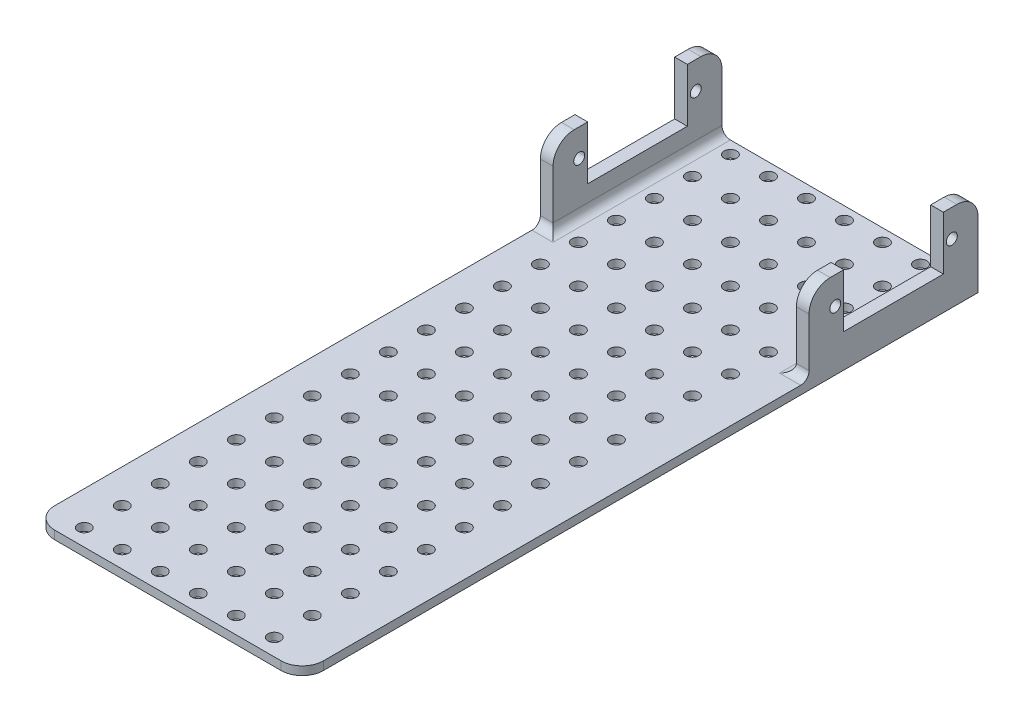
from build123d import *

# Parameters (mm, degrees)
SKETCH1_W               = 45
SKETCH1_H               = 160
BASE_DEPTH              = 2
SKETCH3_W               = 3
SKETCH3_H               = 40
SERVO_HOLDER_DEPTH      = 18.6
FILLET1_R               = 2
FILLET2_R               = 5
SKETCH4_R               = 1.3
SKETCH4_W               = 23.6
SKETCH4_H               = 12.7
CUT_EXTRUDE1_DEPTH      = 3.6
FILLET1_OF_MIRROR1_R    = 2
FILLET2_OF_MIRROR1_R    = 5
SKETCH7_R               = 1.5
CUT_EXTRUDE2_DEPTH      = 1.8
FILL_START              = 0.2
FILL_PATTERN1_OUTLINE_R = 1.5
FILL_PATTERN1_DEPTH     = 1.8
FILLET3_R               = 5


# Read off the part's stored shape, not the designer's step: Fill Pattern1
with BuildPart() as part:
    # Sketch1 → Base (new body)
    with BuildSketch(Plane(origin=(0, 0, 0), x_dir=(1, 0, 0), z_dir=(0, 1, 0))):
        with Locations((-9.312075906, -25.308108108)):
            Rectangle(SKETCH1_W, SKETCH1_H)
    base = extrude(amount=BASE_DEPTH)

    # Sketch3 → Servo Holder (add)
    with BuildSketch(Plane(origin=(0, 2, 0), x_dir=(1, 0, 0), z_dir=(0, 1, 0))):
        with Locations((-30.312075906, 34.691891892)):
            Rectangle(SKETCH3_W, SKETCH3_H)
    servo_holder = extrude(amount=SERVO_HOLDER_DEPTH)

    # Fillet1
    fillet1_edges = [part.edges().sort_by_distance(p)[0] for p in [
        (-30.312075906, 2, -14.691891892),
        (-28.812075906, 2, -34.691891892),
    ]]
    fillet(fillet1_edges, radius=FILLET1_R)

    # Fillet2
    fillet2_edges = [part.edges().sort_by_distance(p)[0] for p in [
        (-30.312075906, 20.6, -14.691891892),
        (-30.312075906, 20.6, -54.691891892),
    ]]
    fillet(fillet2_edges, radius=FILLET2_R)

    # Sketch4 → Cut-Extrude1 (cut)
    with BuildSketch(Plane(origin=(-28.812075906, 0, 0), x_dir=(0, 0, -1), z_dir=(1, 0, 0))):
        with Locations((48.491197795, 14.124093849)):
            Circle(SKETCH4_R)
        with Locations((20.891891892, 14.121060402)):
            Circle(SKETCH4_R)
        with Locations((34.691891892, 14.262501205)):
            Rectangle(SKETCH4_W, SKETCH4_H)
    cut_extrude1 = extrude(amount=-CUT_EXTRUDE1_DEPTH, mode=Mode.SUBTRACT)

    # Mirror1: Base, Servo Holder, Cut-Extrude1 across plane
    add(base.mirror(Plane(origin=(0, 0, 0), x_dir=(0, 0, 1), z_dir=(1, 0, 0))))
    add(servo_holder.mirror(Plane(origin=(0, 0, 0), x_dir=(0, 0, 1), z_dir=(1, 0, 0))))
    add(cut_extrude1.mirror(Plane(origin=(0, 0, 0), x_dir=(0, 0, 1), z_dir=(1, 0, 0))), mode=Mode.SUBTRACT)

    # Fillet1 of Mirror1
    fillet1_of_mirror1_edges = [part.edges().sort_by_distance(p)[0] for p in [
        (30.312075906, 2, -14.691891892),
        (28.812075906, 2, -34.691891892),
    ]]
    fillet(fillet1_of_mirror1_edges, radius=FILLET1_OF_MIRROR1_R)

    # Fillet2 of Mirror1
    fillet2_of_mirror1_edges = [part.edges().sort_by_distance(p)[0] for p in [
        (30.312075906, 20.6, -14.691891892),
        (30.312075906, 20.6, -54.691891892),
    ]]
    fillet(fillet2_of_mirror1_edges, radius=FILLET2_OF_MIRROR1_R)

    # Sketch7 → Cut-Extrude2 (cut)
    with BuildSketch(Plane(origin=(0, 2, 0), x_dir=(1, 0, 0), z_dir=(0, 1, 0))):
        with Locations(Location((-23.812075906, 51.691891892, 0), (0, 0, 270))):
            Circle(SKETCH7_R)
    extrude(amount=-CUT_EXTRUDE2_DEPTH, mode=Mode.SUBTRACT)

    # Fill Pattern1 outline → Fill Pattern1 (cut)
    with BuildSketch(Plane(origin=(0, 0, 0), x_dir=(1, 0, 0), z_dir=(0, 1, 0)).offset(FILL_START)):
        with Locations((21.187924094, -101.308108108)):
            Circle(FILL_PATTERN1_OUTLINE_R)
        with Locations((-14.812075906, 24.691891892)):
            Circle(FILL_PATTERN1_OUTLINE_R)
        with Locations((-5.812075906, 24.691891892)):
            Circle(FILL_PATTERN1_OUTLINE_R)
        with Locations((3.187924094, 24.691891892)):
            Circle(FILL_PATTERN1_OUTLINE_R)
        with Locations((12.187924094, 24.691891892)):
            Circle(FILL_PATTERN1_OUTLINE_R)
        with Locations((-5.812075906, 15.691891892)):
            Circle(FILL_PATTERN1_OUTLINE_R)
        with Locations((-14.812075906, 15.691891892)):
            Circle(FILL_PATTERN1_OUTLINE_R)
        with Locations((-23.812075906, 15.691891892)):
            Circle(FILL_PATTERN1_OUTLINE_R)
        with Locations((21.187924094, 24.691891892)):
            Circle(FILL_PATTERN1_OUTLINE_R)
        with Locations((-5.812075906, 33.691891892)):
            Circle(FILL_PATTERN1_OUTLINE_R)
        with Locations((-14.812075906, 33.691891892)):
            Circle(FILL_PATTERN1_OUTLINE_R)
        with Locations((-23.812075906, 33.691891892)):
            Circle(FILL_PATTERN1_OUTLINE_R)
        with Locations((21.187924094, 42.691891892)):
            Circle(FILL_PATTERN1_OUTLINE_R)
        with Locations((-23.812075906, 24.691891892)):
            Circle(FILL_PATTERN1_OUTLINE_R)
        with Locations((21.187924094, 33.691891892)):
            Circle(FILL_PATTERN1_OUTLINE_R)
        with Locations((12.187924094, 33.691891892)):
            Circle(FILL_PATTERN1_OUTLINE_R)
        with Locations((3.187924094, 33.691891892)):
            Circle(FILL_PATTERN1_OUTLINE_R)
        with Locations((-5.812075906, -2.308108108)):
            Circle(FILL_PATTERN1_OUTLINE_R)
        with Locations((-14.812075906, -2.308108108)):
            Circle(FILL_PATTERN1_OUTLINE_R)
        with Locations((-23.812075906, -2.308108108)):
            Circle(FILL_PATTERN1_OUTLINE_R)
        with Locations((21.187924094, 6.691891892)):
            Circle(FILL_PATTERN1_OUTLINE_R)
        with Locations((-23.812075906, -11.308108108)):
            Circle(FILL_PATTERN1_OUTLINE_R)
        with Locations((21.187924094, -2.308108108)):
            Circle(FILL_PATTERN1_OUTLINE_R)
        with Locations((12.187924094, -2.308108108)):
            Circle(FILL_PATTERN1_OUTLINE_R)
        with Locations((3.187924094, -2.308108108)):
            Circle(FILL_PATTERN1_OUTLINE_R)
        with Locations((-23.812075906, 6.691891892)):
            Circle(FILL_PATTERN1_OUTLINE_R)
        with Locations((21.187924094, 15.691891892)):
            Circle(FILL_PATTERN1_OUTLINE_R)
        with Locations((12.187924094, 15.691891892)):
            Circle(FILL_PATTERN1_OUTLINE_R)
        with Locations((3.187924094, 15.691891892)):
            Circle(FILL_PATTERN1_OUTLINE_R)
        with Locations((-14.812075906, 6.691891892)):
            Circle(FILL_PATTERN1_OUTLINE_R)
        with Locations((-5.812075906, 6.691891892)):
            Circle(FILL_PATTERN1_OUTLINE_R)
        with Locations((3.187924094, 6.691891892)):
            Circle(FILL_PATTERN1_OUTLINE_R)
        with Locations((12.187924094, 6.691891892)):
            Circle(FILL_PATTERN1_OUTLINE_R)
        with Locations((-14.812075906, 51.691891892)):
            Circle(FILL_PATTERN1_OUTLINE_R)
        with Locations((-5.812075906, 51.691891892)):
            Circle(FILL_PATTERN1_OUTLINE_R)
        with Locations((12.187924094, 42.691891892)):
            Circle(FILL_PATTERN1_OUTLINE_R)
        with Locations((3.187924094, 42.691891892)):
            Circle(FILL_PATTERN1_OUTLINE_R)
        with Locations((-5.812075906, 42.691891892)):
            Circle(FILL_PATTERN1_OUTLINE_R)
        with Locations((-14.812075906, 42.691891892)):
            Circle(FILL_PATTERN1_OUTLINE_R)
        with Locations((3.187924094, 51.691891892)):
            Circle(FILL_PATTERN1_OUTLINE_R)
        with Locations((12.187924094, 51.691891892)):
            Circle(FILL_PATTERN1_OUTLINE_R)
        with Locations((21.187924094, 51.691891892)):
            Circle(FILL_PATTERN1_OUTLINE_R)
        with Locations((-23.812075906, 42.691891892)):
            Circle(FILL_PATTERN1_OUTLINE_R)
        with Locations((-5.812075906, -74.308108108)):
            Circle(FILL_PATTERN1_OUTLINE_R)
        with Locations((-14.812075906, -74.308108108)):
            Circle(FILL_PATTERN1_OUTLINE_R)
        with Locations((-23.812075906, -74.308108108)):
            Circle(FILL_PATTERN1_OUTLINE_R)
        with Locations((21.187924094, -65.308108108)):
            Circle(FILL_PATTERN1_OUTLINE_R)
        with Locations((-23.812075906, -83.308108108)):
            Circle(FILL_PATTERN1_OUTLINE_R)
        with Locations((21.187924094, -74.308108108)):
            Circle(FILL_PATTERN1_OUTLINE_R)
        with Locations((12.187924094, -74.308108108)):
            Circle(FILL_PATTERN1_OUTLINE_R)
        with Locations((3.187924094, -74.308108108)):
            Circle(FILL_PATTERN1_OUTLINE_R)
        with Locations((-23.812075906, -65.308108108)):
            Circle(FILL_PATTERN1_OUTLINE_R)
        with Locations((21.187924094, -56.308108108)):
            Circle(FILL_PATTERN1_OUTLINE_R)
        with Locations((12.187924094, -56.308108108)):
            Circle(FILL_PATTERN1_OUTLINE_R)
        with Locations((3.187924094, -56.308108108)):
            Circle(FILL_PATTERN1_OUTLINE_R)
        with Locations((-14.812075906, -65.308108108)):
            Circle(FILL_PATTERN1_OUTLINE_R)
        with Locations((-5.812075906, -65.308108108)):
            Circle(FILL_PATTERN1_OUTLINE_R)
        with Locations((3.187924094, -65.308108108)):
            Circle(FILL_PATTERN1_OUTLINE_R)
        with Locations((12.187924094, -65.308108108)):
            Circle(FILL_PATTERN1_OUTLINE_R)
        with Locations((-23.812075906, -101.308108108)):
            Circle(FILL_PATTERN1_OUTLINE_R)
        with Locations((21.187924094, -92.308108108)):
            Circle(FILL_PATTERN1_OUTLINE_R)
        with Locations((12.187924094, -92.308108108)):
            Circle(FILL_PATTERN1_OUTLINE_R)
        with Locations((3.187924094, -92.308108108)):
            Circle(FILL_PATTERN1_OUTLINE_R)
        with Locations((-14.812075906, -101.308108108)):
            Circle(FILL_PATTERN1_OUTLINE_R)
        with Locations((-5.812075906, -101.308108108)):
            Circle(FILL_PATTERN1_OUTLINE_R)
        with Locations((3.187924094, -101.308108108)):
            Circle(FILL_PATTERN1_OUTLINE_R)
        with Locations((12.187924094, -101.308108108)):
            Circle(FILL_PATTERN1_OUTLINE_R)
        with Locations((-14.812075906, -83.308108108)):
            Circle(FILL_PATTERN1_OUTLINE_R)
        with Locations((-5.812075906, -83.308108108)):
            Circle(FILL_PATTERN1_OUTLINE_R)
        with Locations((3.187924094, -83.308108108)):
            Circle(FILL_PATTERN1_OUTLINE_R)
        with Locations((12.187924094, -83.308108108)):
            Circle(FILL_PATTERN1_OUTLINE_R)
        with Locations((-5.812075906, -92.308108108)):
            Circle(FILL_PATTERN1_OUTLINE_R)
        with Locations((-14.812075906, -92.308108108)):
            Circle(FILL_PATTERN1_OUTLINE_R)
        with Locations((-23.812075906, -92.308108108)):
            Circle(FILL_PATTERN1_OUTLINE_R)
        with Locations((21.187924094, -83.308108108)):
            Circle(FILL_PATTERN1_OUTLINE_R)
        with Locations((-23.812075906, -29.308108108)):
            Circle(FILL_PATTERN1_OUTLINE_R)
        with Locations((21.187924094, -20.308108108)):
            Circle(FILL_PATTERN1_OUTLINE_R)
        with Locations((12.187924094, -20.308108108)):
            Circle(FILL_PATTERN1_OUTLINE_R)
        with Locations((3.187924094, -20.308108108)):
            Circle(FILL_PATTERN1_OUTLINE_R)
        with Locations((-14.812075906, -29.308108108)):
            Circle(FILL_PATTERN1_OUTLINE_R)
        with Locations((-5.812075906, -29.308108108)):
            Circle(FILL_PATTERN1_OUTLINE_R)
        with Locations((3.187924094, -29.308108108)):
            Circle(FILL_PATTERN1_OUTLINE_R)
        with Locations((12.187924094, -29.308108108)):
            Circle(FILL_PATTERN1_OUTLINE_R)
        with Locations((-14.812075906, -11.308108108)):
            Circle(FILL_PATTERN1_OUTLINE_R)
        with Locations((-5.812075906, -11.308108108)):
            Circle(FILL_PATTERN1_OUTLINE_R)
        with Locations((3.187924094, -11.308108108)):
            Circle(FILL_PATTERN1_OUTLINE_R)
        with Locations((12.187924094, -11.308108108)):
            Circle(FILL_PATTERN1_OUTLINE_R)
        with Locations((-5.812075906, -20.308108108)):
            Circle(FILL_PATTERN1_OUTLINE_R)
        with Locations((-14.812075906, -20.308108108)):
            Circle(FILL_PATTERN1_OUTLINE_R)
        with Locations((-23.812075906, -20.308108108)):
            Circle(FILL_PATTERN1_OUTLINE_R)
        with Locations((21.187924094, -11.308108108)):
            Circle(FILL_PATTERN1_OUTLINE_R)
        with Locations((-14.812075906, -47.308108108)):
            Circle(FILL_PATTERN1_OUTLINE_R)
        with Locations((-5.812075906, -47.308108108)):
            Circle(FILL_PATTERN1_OUTLINE_R)
        with Locations((3.187924094, -47.308108108)):
            Circle(FILL_PATTERN1_OUTLINE_R)
        with Locations((12.187924094, -47.308108108)):
            Circle(FILL_PATTERN1_OUTLINE_R)
        with Locations((-5.812075906, -56.308108108)):
            Circle(FILL_PATTERN1_OUTLINE_R)
        with Locations((-14.812075906, -56.308108108)):
            Circle(FILL_PATTERN1_OUTLINE_R)
        with Locations((-23.812075906, -56.308108108)):
            Circle(FILL_PATTERN1_OUTLINE_R)
        with Locations((21.187924094, -47.308108108)):
            Circle(FILL_PATTERN1_OUTLINE_R)
        with Locations((-5.812075906, -38.308108108)):
            Circle(FILL_PATTERN1_OUTLINE_R)
        with Locations((-14.812075906, -38.308108108)):
            Circle(FILL_PATTERN1_OUTLINE_R)
        with Locations((-23.812075906, -38.308108108)):
            Circle(FILL_PATTERN1_OUTLINE_R)
        with Locations((21.187924094, -29.308108108)):
            Circle(FILL_PATTERN1_OUTLINE_R)
        with Locations((-23.812075906, -47.308108108)):
            Circle(FILL_PATTERN1_OUTLINE_R)
        with Locations((21.187924094, -38.308108108)):
            Circle(FILL_PATTERN1_OUTLINE_R)
        with Locations((12.187924094, -38.308108108)):
            Circle(FILL_PATTERN1_OUTLINE_R)
        with Locations((3.187924094, -38.308108108)):
            Circle(FILL_PATTERN1_OUTLINE_R)
    extrude(amount=FILL_PATTERN1_DEPTH, mode=Mode.SUBTRACT)

    # Fillet3
    fillet3_edges = [part.edges().sort_by_distance(p)[0] for p in [
        (-31.812075906, 1, 105.308108108),
        (31.812075906, 1, 105.308108108),
    ]]
    fillet(fillet3_edges, radius=FILLET3_R)


solid = part.part
